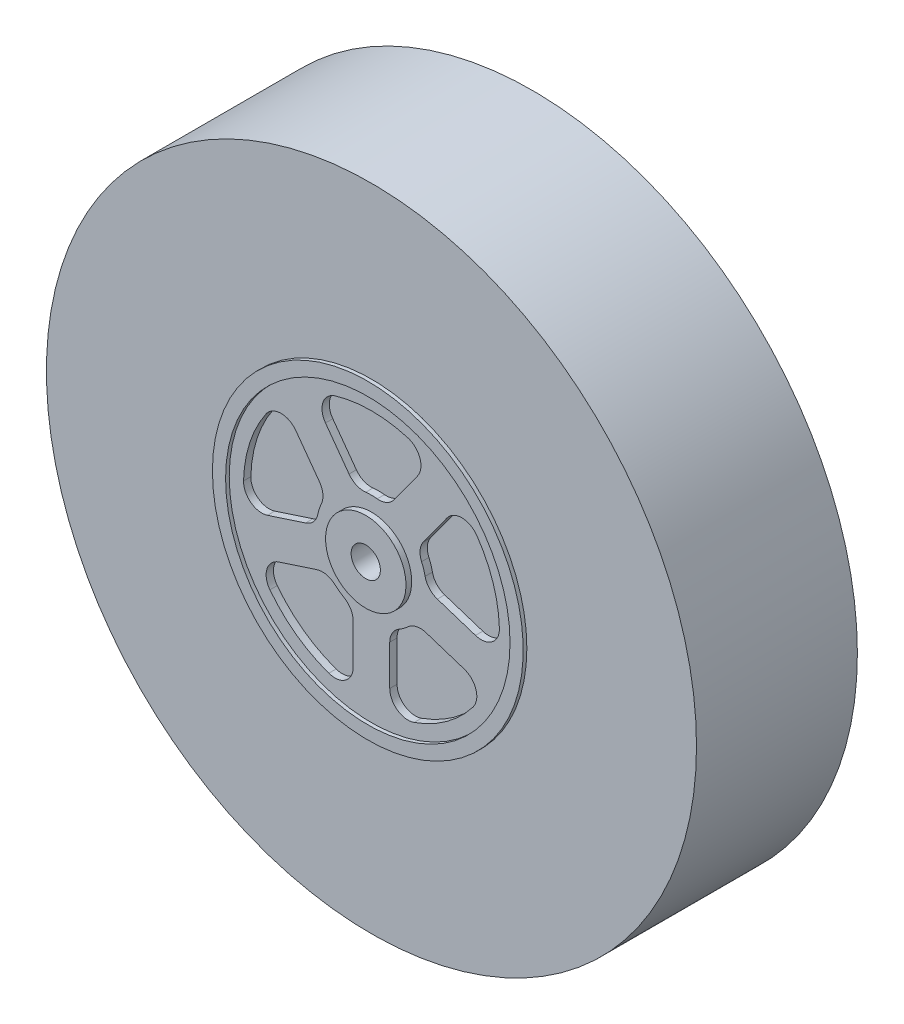
from build123d import *
from build123d.topology import SkipClean

# Parameters (mm, degrees)
SKETCH1_R                = 44.45
SKETCH1_R_2              = 2
BOSS_EXTRUDE1_DEPTH      = 11
BOSS_EXTRUDE3_START      = 0.5
SKETCH3_R                = 21.25
SKETCH3_R_2              = 2
BOSS_EXTRUDE3_DEPTH      = 0.5
CUT_EXTRUDE1_DEPTH       = 1.5
FILLET1_R                = 2.5
CIRPATTERN1_COUNT        = 5
FILLET1_OF_CIRPATTERN1_R = 2.5
SKETCH5_R                = 19.45
CUT_EXTRUDE2_DEPTH       = 0.5
BOSS_EXTRUDE4_START      = 0.78
SKETCH6_R                = 5.5
SKETCH6_R_2              = 2
BOSS_EXTRUDE4_DEPTH      = 0.78
MIRROR1_START            = 10
MIRROR1_DEPTH            = 1
MIRROR1_START_2          = 11
MIRROR1_2_OUTLINE_R      = 21.25
MIRROR1_2_OUTLINE_R_2    = 19.45
MIRROR1_2_OUTLINE_R_3    = 5.5
MIRROR1_2_OUTLINE_R_4    = 2
MIRROR1_2_DEPTH          = 0.5
MIRROR1_START_3          = 11.5
MIRROR1_3_OUTLINE_R      = 5.5
MIRROR1_3_OUTLINE_R_2    = 2
MIRROR1_3_DEPTH          = 0.28


# Read off the part's stored shape, not the designer's step: Mirror1
with BuildPart() as part:
    # Sketch1 → Boss-Extrude1 (new, symmetric)
    with BuildSketch(Plane.XY):
        Circle(SKETCH1_R)
        Circle(SKETCH1_R_2, mode=Mode.SUBTRACT)
    extrude(amount=BOSS_EXTRUDE1_DEPTH, both=True)

    # Sketch3 → Boss-Extrude3 (add)
    with SkipClean():  # the faces are left unmerged after this step: merging them gives an invalid solid
        with BuildSketch(Plane(origin=(0, 0, -11), x_dir=(-1, 0, 0), z_dir=(0, 0, -1)).offset(BOSS_EXTRUDE3_START)):
            with Locations(Location((0, 0, 0), (0, 0, 180))):
                Circle(SKETCH3_R)
            Circle(SKETCH3_R_2, mode=Mode.SUBTRACT)
        extrude(amount=-BOSS_EXTRUDE3_DEPTH)

    # Sketch4 → Cut-Extrude1 (cut)
    with SkipClean():  # the faces are left unmerged after this step: merging them gives an invalid solid
        with BuildSketch(Plane(origin=(0, 0, -11.5), x_dir=(-1, 0, 0), z_dir=(0, 0, -1))):
            with BuildLine():
                Line((8.158196723, 15.482048515), (2.133726892, 7.190077159))
                ThreePointArc((2.133726892, 7.190077159), (0, 7.5), (-2.133726892, 7.190077159))
                Line((-2.133726892, 7.190077159), (-8.158196723, 15.482048515))
                ThreePointArc((-8.158196723, 15.482048515), (0, 17.5), (8.158196723, 15.482048515))
            make_face()
        cut_extrude1 = extrude(amount=-CUT_EXTRUDE1_DEPTH, mode=Mode.SUBTRACT)

    # Fillet1
    fillet1_edges = [part.edges().sort_by_distance(p)[0] for p in [
        (8.158196723, 15.482048515, -10.75),
        (-8.158196723, 15.482048515, -10.75),
        (-2.133726892, 7.190077159, -10.75),
        (2.133726892, 7.190077159, -10.75),
    ]]
    fillet(fillet1_edges, radius=FILLET1_R)

    # CirPattern1: Cut-Extrude1 ×5 about axis
    cirpattern1_axis = Axis((0, 0, 0), (0, 0, 1))
    for i in range(1, CIRPATTERN1_COUNT):
        add(cut_extrude1.rotate(cirpattern1_axis, i * 360 / CIRPATTERN1_COUNT), mode=Mode.SUBTRACT)

    # Fillet1 of CirPattern1
    fillet1_of_cirpattern1_edges = [part.edges().sort_by_distance(p)[0] for p in [
        (-12.203281695, 12.543122254, -10.75),
        (-17.245324557, -2.974690056, -10.75),
        (-7.497527606, 0.192561168, -10.75),
        (-6.178811864, 4.251150897, -10.75),
        (-15.700239585, -7.729972637, -10.75),
        (-2.5, -17.320508076, -10.75),
        (-2.5, -7.071067812, -10.75),
        (-5.952442634, -4.562721413, -10.75),
        (2.5, -17.320508076, -10.75),
        (15.700239585, -7.729972637, -10.75),
        (5.952442634, -4.562721413, -10.75),
        (2.5, -7.071067812, -10.75),
        (17.245324557, -2.974690056, -10.75),
        (12.203281695, 12.543122254, -10.75),
        (6.178811864, 4.251150897, -10.75),
        (7.497527606, 0.192561168, -10.75),
    ]]
    fillet(fillet1_of_cirpattern1_edges, radius=FILLET1_OF_CIRPATTERN1_R)

    # Sketch5 → Cut-Extrude2 (cut)
    with BuildSketch(Plane(origin=(0, 0, -11.5), x_dir=(-1, 0, 0), z_dir=(0, 0, -1))):
        Circle(SKETCH5_R)
    extrude(amount=-CUT_EXTRUDE2_DEPTH, mode=Mode.SUBTRACT)

    # Sketch6 → Boss-Extrude4 (add)
    with BuildSketch(Plane(origin=(0, 0, -11), x_dir=(-1, 0, 0), z_dir=(0, 0, -1)).offset(BOSS_EXTRUDE4_START)):
        with Locations(Location((0, 0, 0), (0, 0, 180))):
            Circle(SKETCH6_R)
        Circle(SKETCH6_R_2, mode=Mode.SUBTRACT)
    extrude(amount=-BOSS_EXTRUDE4_DEPTH)

    # Mirror1 outline → Mirror1 (cut)
    with BuildSketch(Plane.XY.offset(MIRROR1_START)):
        with BuildLine():
            Line((-7.46384855, -5.053806964), (-12.677427753, -6.747801535))
            ThreePointArc((-12.677427753, -6.747801535), (-14.292248864, -8.383489285), (-13.889032812, -10.646349964))
            ThreePointArc((-13.889032812, -10.646349964), (-10.286241915, -14.157797402), (-5.833333333, -16.499158228))
            ThreePointArc((-5.833333333, -16.499158228), (-3.556624327, -16.183377076), (-2.5, -14.142135624))
            Line((-2.5, -14.142135624), (-2.5, -8.660254038))
            ThreePointArc((-2.5, -8.660254038), (-2.834936491, -7.410254038), (-3.75, -6.495190528))
            ThreePointArc((-3.75, -6.495190528), (-4.408389392, -6.067627458), (-5.018479548, -5.573586191))
            ThreePointArc((-5.018479548, -5.573586191), (-6.171526837, -4.986079253), (-7.46384855, -5.053806964))
        make_face()
        with BuildLine():
            ThreePointArc((5.018479548, -5.573586191), (4.408389392, -6.067627458), (3.75, -6.495190528))
            ThreePointArc((3.75, -6.495190528), (2.834936491, -7.410254038), (2.5, -8.660254038))
            Line((2.5, -8.660254038), (2.5, -14.142135624))
            ThreePointArc((2.5, -14.142135624), (3.556624327, -16.183377076), (5.833333333, -16.499158228))
            ThreePointArc((5.833333333, -16.499158228), (10.286241915, -14.157797402), (13.889032812, -10.646349964))
            ThreePointArc((13.889032812, -10.646349964), (14.292248864, -8.383489285), (12.677427753, -6.747801535))
            Line((12.677427753, -6.747801535), (7.46384855, -5.053806964))
            ThreePointArc((7.46384855, -5.053806964), (6.171526837, -4.986079253), (5.018479548, -5.573586191))
        make_face()
        with BuildLine():
            ThreePointArc((6.851590932, 3.050524823), (7.132923872, 2.317627458), (7.336107006, 1.559337681))
            ThreePointArc((7.336107006, 1.559337681), (7.923613944, 0.406290392), (9.008933521, -0.298524383))
            Line((9.008933521, -0.298524383), (14.222512725, -1.992518954))
            ThreePointArc((14.222512725, -1.992518954), (16.490363583, -1.618387801), (17.49423108, 0.449309393))
            ThreePointArc((17.49423108, 0.449309393), (16.643489035, 5.407797401), (14.417227682, 9.919352094))
            ThreePointArc((14.417227682, 9.919352094), (12.389719901, 11.002095754), (10.335081241, 9.971764926))
            Line((10.335081241, 9.971764926), (7.11291209, 5.536829561))
            ThreePointArc((7.11291209, 5.536829561), (6.649149838, 4.328687589), (6.851590932, 3.050524823))
        make_face()
        with BuildLine():
            ThreePointArc((-0.783963475, 7.458914215), (0, 7.5), (0.783963475, 7.458914215))
            ThreePointArc((0.783963475, 7.458914215), (2.062126241, 7.66135531), (3.067827119, 8.475755823))
            Line((3.067827119, 8.475755823), (6.28999627, 12.910691187))
            ThreePointArc((6.28999627, 12.910691187), (6.634980854, 15.183158408), (4.978696081, 16.776846704))
            ThreePointArc((4.978696081, 16.776846704), (0, 17.5), (-4.978696081, 16.776846704))
            ThreePointArc((-4.978696081, 16.776846704), (-6.634980854, 15.183158408), (-6.28999627, 12.910691187))
            Line((-6.28999627, 12.910691187), (-3.067827119, 8.475755823))
            ThreePointArc((-3.067827119, 8.475755823), (-2.062126241, 7.66135531), (-0.783963475, 7.458914215))
        make_face()
        with BuildLine():
            ThreePointArc((-7.336107006, 1.559337681), (-7.132923872, 2.317627458), (-6.851590932, 3.050524823))
            ThreePointArc((-6.851590932, 3.050524823), (-6.649149838, 4.328687589), (-7.11291209, 5.536829561))
            Line((-7.11291209, 5.536829561), (-10.335081241, 9.971764926))
            ThreePointArc((-10.335081241, 9.971764926), (-12.389719901, 11.002095754), (-14.417227682, 9.919352094))
            ThreePointArc((-14.417227682, 9.919352094), (-16.643489035, 5.407797401), (-17.49423108, 0.449309393))
            ThreePointArc((-17.49423108, 0.449309393), (-16.490363583, -1.618387801), (-14.222512725, -1.992518954))
            Line((-14.222512725, -1.992518954), (-9.008933521, -0.298524383))
            ThreePointArc((-9.008933521, -0.298524383), (-7.923613944, 0.406290392), (-7.336107006, 1.559337681))
        make_face()
    extrude(amount=MIRROR1_DEPTH, mode=Mode.SUBTRACT)

    # Mirror1 2 outline → Mirror1 2 (add)
    # profile 1 of 2: a face of its own
    with BuildSketch(Plane.XY.offset(MIRROR1_START_2)):
        Circle(MIRROR1_2_OUTLINE_R)
        Circle(MIRROR1_2_OUTLINE_R_2, mode=Mode.SUBTRACT)
    # profile 2 of 2: a face of its own
    with BuildSketch(Plane.XY.offset(MIRROR1_START_2)):
        Circle(MIRROR1_2_OUTLINE_R_3)
        Circle(MIRROR1_2_OUTLINE_R_4, mode=Mode.SUBTRACT)
    extrude(amount=MIRROR1_2_DEPTH)

    # Mirror1 3 outline → Mirror1 3 (add)
    with BuildSketch(Plane.XY.offset(MIRROR1_START_3)):
        Circle(MIRROR1_3_OUTLINE_R)
        Circle(MIRROR1_3_OUTLINE_R_2, mode=Mode.SUBTRACT)
    extrude(amount=MIRROR1_3_DEPTH)


solid = part.part
